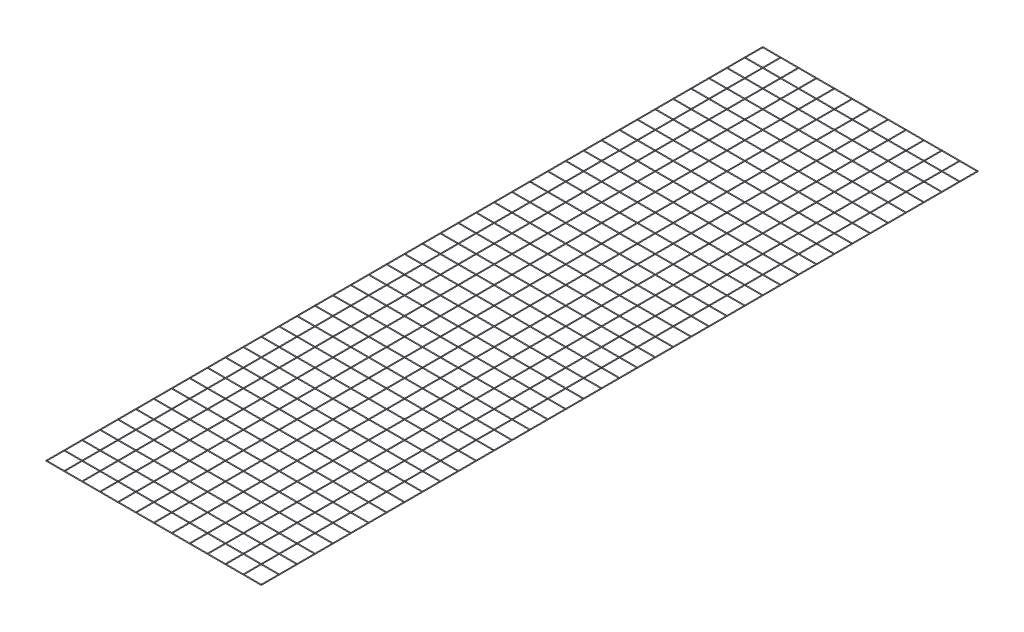
from build123d import *

# Parameters (mm, degrees)
SCHIZZO1_R                      = 1
ESTRUSIONE_ESTRUSIONE1_DEPTH    = 2000
ESTRUSIONE_ESTRUSIONE1_2_DEPTH  = 2000
ESTRUSIONE_ESTRUSIONE1_3_DEPTH  = 2000
ESTRUSIONE_ESTRUSIONE1_4_DEPTH  = 2000
ESTRUSIONE_ESTRUSIONE1_5_DEPTH  = 2000
ESTRUSIONE_ESTRUSIONE1_6_DEPTH  = 2000
ESTRUSIONE_ESTRUSIONE1_7_DEPTH  = 2000
ESTRUSIONE_ESTRUSIONE1_8_DEPTH  = 2000
ESTRUSIONE_ESTRUSIONE1_9_DEPTH  = 2000
ESTRUSIONE_ESTRUSIONE1_10_DEPTH = 2000
ESTRUSIONE_ESTRUSIONE1_11_DEPTH = 2000
ESTRUSIONE_ESTRUSIONE1_12_DEPTH = 2000
ESTRUSIONE_ESTRUSIONE1_13_DEPTH = 2000
SCHIZZO2_R                      = 1
ESTRUSIONE_ESTRUSIONE2_DEPTH    = 600


with BuildPart() as part:
    # Schizzo1 → Estrusione-Estrusione1 (new body)
    with BuildSketch(Plane.XY):
        Circle(SCHIZZO1_R)
    extrude(amount=ESTRUSIONE_ESTRUSIONE1_DEPTH)



with BuildPart() as body_2:
    # Schizzo1 → Estrusione-Estrusione1 2 (new body)
    with BuildSketch(Plane.XY):
        with Locations((50, 0)):
            Circle(SCHIZZO1_R)
    extrude(amount=ESTRUSIONE_ESTRUSIONE1_2_DEPTH)


with BuildPart() as body_3:
    # Schizzo1 → Estrusione-Estrusione1 3 (new body)
    with BuildSketch(Plane.XY):
        with Locations((100, 0)):
            Circle(SCHIZZO1_R)
    extrude(amount=ESTRUSIONE_ESTRUSIONE1_3_DEPTH)


with BuildPart() as body_4:
    # Schizzo1 → Estrusione-Estrusione1 4 (new body)
    with BuildSketch(Plane.XY):
        with Locations((150, 0)):
            Circle(SCHIZZO1_R)
    extrude(amount=ESTRUSIONE_ESTRUSIONE1_4_DEPTH)


with BuildPart() as body_5:
    # Schizzo1 → Estrusione-Estrusione1 5 (new body)
    with BuildSketch(Plane.XY):
        with Locations((200, 0)):
            Circle(SCHIZZO1_R)
    extrude(amount=ESTRUSIONE_ESTRUSIONE1_5_DEPTH)


with BuildPart() as body_6:
    # Schizzo1 → Estrusione-Estrusione1 6 (new body)
    with BuildSketch(Plane.XY):
        with Locations((250, 0)):
            Circle(SCHIZZO1_R)
    extrude(amount=ESTRUSIONE_ESTRUSIONE1_6_DEPTH)


with BuildPart() as body_7:
    # Schizzo1 → Estrusione-Estrusione1 7 (new body)
    with BuildSketch(Plane.XY):
        with Locations((300, 0)):
            Circle(SCHIZZO1_R)
    extrude(amount=ESTRUSIONE_ESTRUSIONE1_7_DEPTH)


with BuildPart() as body_8:
    # Schizzo1 → Estrusione-Estrusione1 8 (new body)
    with BuildSketch(Plane.XY):
        with Locations((350, 0)):
            Circle(SCHIZZO1_R)
    extrude(amount=ESTRUSIONE_ESTRUSIONE1_8_DEPTH)


with BuildPart() as body_9:
    # Schizzo1 → Estrusione-Estrusione1 9 (new body)
    with BuildSketch(Plane.XY):
        with Locations((400, 0)):
            Circle(SCHIZZO1_R)
    extrude(amount=ESTRUSIONE_ESTRUSIONE1_9_DEPTH)


with BuildPart() as body_10:
    # Schizzo1 → Estrusione-Estrusione1 10 (new body)
    with BuildSketch(Plane.XY):
        with Locations((450, 0)):
            Circle(SCHIZZO1_R)
    extrude(amount=ESTRUSIONE_ESTRUSIONE1_10_DEPTH)


with BuildPart() as body_11:
    # Schizzo1 → Estrusione-Estrusione1 11 (new body)
    with BuildSketch(Plane.XY):
        with Locations((500, 0)):
            Circle(SCHIZZO1_R)
    extrude(amount=ESTRUSIONE_ESTRUSIONE1_11_DEPTH)


with BuildPart() as body_12:
    # Schizzo1 → Estrusione-Estrusione1 12 (new body)
    with BuildSketch(Plane.XY):
        with Locations((550, 0)):
            Circle(SCHIZZO1_R)
    extrude(amount=ESTRUSIONE_ESTRUSIONE1_12_DEPTH)


with BuildPart() as body_13:
    # Schizzo1 → Estrusione-Estrusione1 13 (new body)
    with BuildSketch(Plane.XY):
        with Locations((600, 0)):
            Circle(SCHIZZO1_R)
    extrude(amount=ESTRUSIONE_ESTRUSIONE1_13_DEPTH)


with BuildPart() as part_1:
    add(part.part)

    add(body_2.part)  # Estrusione-Estrusione2 merges body 2

    add(body_3.part)  # Estrusione-Estrusione2 merges body 3

    add(body_4.part)  # Estrusione-Estrusione2 merges body 4

    add(body_5.part)  # Estrusione-Estrusione2 merges body 5

    add(body_6.part)  # Estrusione-Estrusione2 merges body 6

    add(body_7.part)  # Estrusione-Estrusione2 merges body 7

    add(body_8.part)  # Estrusione-Estrusione2 merges body 8

    add(body_9.part)  # Estrusione-Estrusione2 merges body 9

    add(body_10.part)  # Estrusione-Estrusione2 merges body 10

    add(body_11.part)  # Estrusione-Estrusione2 merges body 11

    add(body_12.part)  # Estrusione-Estrusione2 merges body 12

    add(body_13.part)  # Estrusione-Estrusione2 merges body 13
    # Schizzo2 → Estrusione-Estrusione2 (add)
    with BuildSketch(Plane(origin=(0, 0, 0), x_dir=(0, 0, -1), z_dir=(1, 0, 0))):
        Circle(SCHIZZO2_R)
        with Locations((-50, 0)):
            Circle(SCHIZZO2_R)
        with Locations((-100, 0)):
            Circle(SCHIZZO2_R)
        with Locations((-150, 0)):
            Circle(SCHIZZO2_R)
        with Locations((-200, 0)):
            Circle(SCHIZZO2_R)
        with Locations((-250, 0)):
            Circle(SCHIZZO2_R)
        with Locations((-300, 0)):
            Circle(SCHIZZO2_R)
        with Locations((-350, 0)):
            Circle(SCHIZZO2_R)
        with Locations((-400, 0)):
            Circle(SCHIZZO2_R)
        with Locations((-450, 0)):
            Circle(SCHIZZO2_R)
        with Locations((-500, 0)):
            Circle(SCHIZZO2_R)
        with Locations((-550, 0)):
            Circle(SCHIZZO2_R)
        with Locations((-600, 0)):
            Circle(SCHIZZO2_R)
        with Locations((-650, 0)):
            Circle(SCHIZZO2_R)
        with Locations((-700, 0)):
            Circle(SCHIZZO2_R)
        with Locations((-750, 0)):
            Circle(SCHIZZO2_R)
        with Locations((-800, 0)):
            Circle(SCHIZZO2_R)
        with Locations((-850, 0)):
            Circle(SCHIZZO2_R)
        with Locations((-900, 0)):
            Circle(SCHIZZO2_R)
        with Locations((-950, 0)):
            Circle(SCHIZZO2_R)
        with Locations((-1000, 0)):
            Circle(SCHIZZO2_R)
        with Locations((-1050, 0)):
            Circle(SCHIZZO2_R)
        with Locations((-1100, 0)):
            Circle(SCHIZZO2_R)
        with Locations((-1150, 0)):
            Circle(SCHIZZO2_R)
        with Locations((-1200, 0)):
            Circle(SCHIZZO2_R)
        with Locations((-1250, 0)):
            Circle(SCHIZZO2_R)
        with Locations((-1300, 0)):
            Circle(SCHIZZO2_R)
        with Locations((-1350, 0)):
            Circle(SCHIZZO2_R)
        with Locations((-1400, 0)):
            Circle(SCHIZZO2_R)
        with Locations((-1450, 0)):
            Circle(SCHIZZO2_R)
        with Locations((-1500, 0)):
            Circle(SCHIZZO2_R)
        with Locations((-1550, 0)):
            Circle(SCHIZZO2_R)
        with Locations((-1600, 0)):
            Circle(SCHIZZO2_R)
        with Locations((-1650, 0)):
            Circle(SCHIZZO2_R)
        with Locations((-1700, 0)):
            Circle(SCHIZZO2_R)
        with Locations((-1750, 0)):
            Circle(SCHIZZO2_R)
        with Locations((-1800, 0)):
            Circle(SCHIZZO2_R)
        with Locations((-1850, 0)):
            Circle(SCHIZZO2_R)
        with Locations((-1900, 0)):
            Circle(SCHIZZO2_R)
        with Locations((-1950, 0)):
            Circle(SCHIZZO2_R)
        with Locations((-2000, 0)):
            Circle(SCHIZZO2_R)
    extrude(amount=ESTRUSIONE_ESTRUSIONE2_DEPTH)


solid = part_1.part
